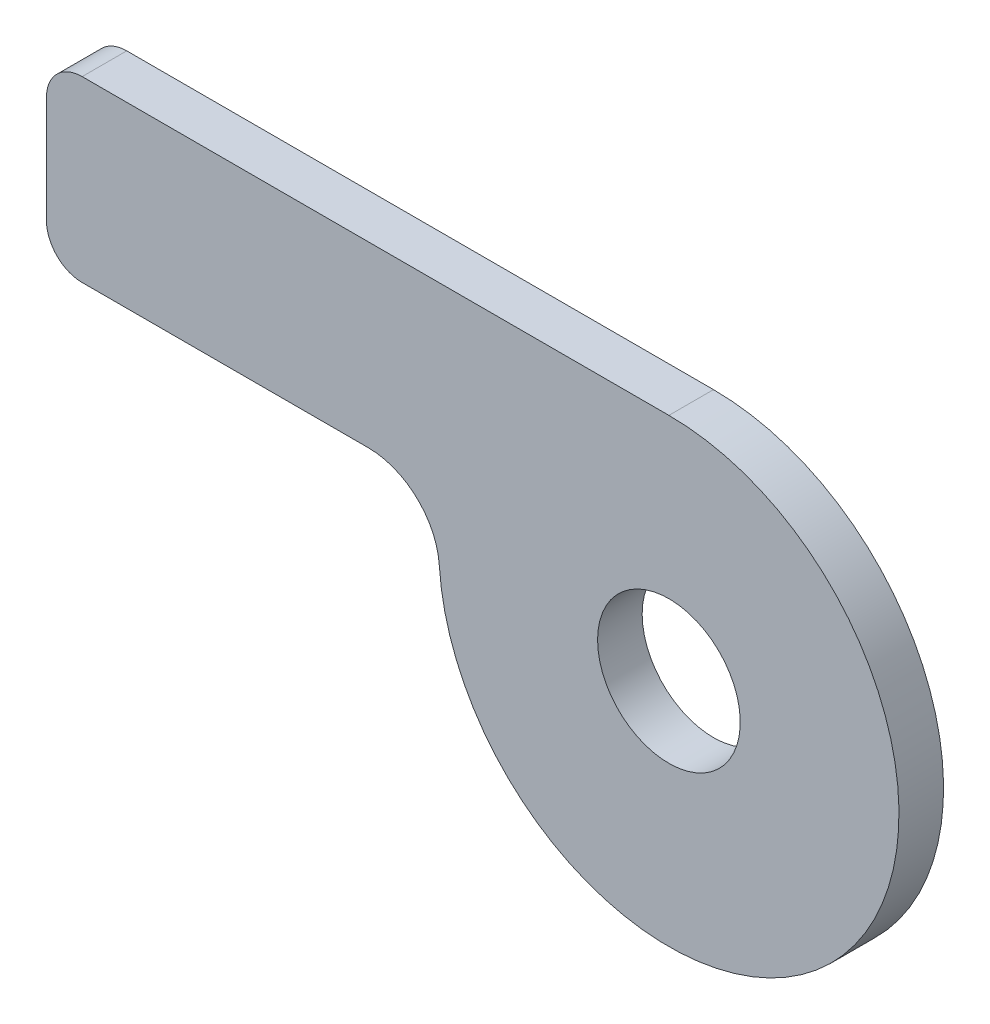
from build123d import *

# Parameters (mm, degrees)
SKETCH2_W           = 13.97
SKETCH2_H           = 6.35
BOSS_EXTRUDE1_DEPTH = 1.5875
WRAP1_START         = -0.0762
WRAP1_DEPTH         = 0.0762
BOSS_EXTRUDE2_DEPTH = 1.5875
FILLET1_R           = 2.54
SKETCH5_R           = 2.54
CUT_EXTRUDE1_DEPTH  = 33.375847382
FILLET2_R           = 1.27


# Read off the part's stored shape, not the designer's step: Wrap1
with BuildPart() as part:
    # Sketch2 → Boss-Extrude1 (new body)
    with BuildSketch(Plane.XY):
        with Locations((0, -9.144)):
            Rectangle(SKETCH2_W, SKETCH2_H)
    extrude(amount=BOSS_EXTRUDE1_DEPTH)

    # Wrap1 outline → Wrap1 (cut)
    # profile 1 of 3: a face of its own
    with BuildSketch(Plane(origin=(0, 0, 0), x_dir=(-1, 0, 0), z_dir=(0, 0, -1)).offset(WRAP1_START)):
        with BuildLine():
            add(Edge.make_bspline(
                [(-2.647697623, -7.156673999), (-2.700141722, -7.157990717), (-2.803561737, -7.160587291), (-2.95654894, -7.175584212), (-3.104871573, -7.200760896), (-3.248840584, -7.235209573), (-3.388264056, -7.279418681), (-3.523751822, -7.332718225), (-3.654761282, -7.396442796), (-3.780864658, -7.469338074), (-3.901337576, -7.550619015), (-4.013349659, -7.641820928), (-4.117563586, -7.741198922), (-4.213542217, -7.848882831), (-4.300966588, -7.965414437), (-4.379096688, -8.09075528), (-4.450765358, -8.223827059), (-4.490467199, -8.317653514), (-4.510645471, -8.365340362)],
                knots=[0, 0, 0, 0, 0.066519919, 0.131177599, 0.194761122, 0.257192137, 0.318771417, 0.380120674, 0.441686552, 0.503359563, 0.564724062, 0.625801011, 0.68633058, 0.747180128, 0.808544627, 0.870848624, 0.934359429, 1, 1, 1, 1], degree=3))
            add(Edge.make_bspline(
                [(-4.510645471, -8.365340362), (-4.527049856, -8.412005616), (-4.558801406, -8.50232867), (-4.59758291, -8.636036705), (-4.626063685, -8.763161633), (-4.644365509, -8.88229651), (-4.65610472, -8.990504557), (-4.66232732, -9.085306839), (-4.668515846, -9.165294299), (-4.667859131, -9.213742427), (-4.667564777, -9.235457917)],
                knots=[0, 0, 0, 0, 0.166884492, 0.32301371, 0.469462925, 0.606133475, 0.729510425, 0.836585524, 0.926754125, 1, 1, 1, 1], degree=3))
            add(Edge.make_bspline(
                [(-4.667564777, -9.235457917), (-4.664882988, -9.289623356), (-4.659653011, -9.395255787), (-4.644374873, -9.549374923), (-4.620634185, -9.694119159), (-4.591262562, -9.830361514), (-4.553570782, -9.956861765), (-4.509897614, -10.075001199), (-4.457883705, -10.18342197), (-4.399712241, -10.282754496), (-4.338280071, -10.373361413), (-4.276971758, -10.45640658), (-4.217321352, -10.532542421), (-4.159638706, -10.602224618), (-4.101572004, -10.663141537), (-4.044803736, -10.716879151), (-3.989521034, -10.76380347), (-3.950941988, -10.789800804), (-3.932397825, -10.802297194)],
                knots=[0, 0, 0, 0, 0.090547377, 0.176583808, 0.25842749, 0.335350079, 0.409134528, 0.478645697, 0.545446999, 0.609635042, 0.670678521, 0.72814981, 0.781962462, 0.832172751, 0.879124948, 0.922373067, 0.962686312, 1, 1, 1, 1], degree=3))
            add(Edge.make_bspline(
                [(-3.932397825, -10.802297194), (-3.899575004, -10.822649404), (-3.835101069, -10.862627292), (-3.737583222, -10.918047869), (-3.640336411, -10.966559062), (-3.543782489, -11.009176845), (-3.447774681, -11.045130285), (-3.352898685, -11.076135452), (-3.258471568, -11.100288494), (-3.165713454, -11.119157648), (-3.07638712, -11.13198399), (-2.993163041, -11.145490843), (-2.916110361, -11.154302727), (-2.845563977, -11.162560374), (-2.781457203, -11.168046007), (-2.723900707, -11.171284009), (-2.67284163, -11.172408774), (-2.640949134, -11.170953208), (-2.626044597, -11.170272969)],
                knots=[0, 0, 0, 0, 0.084081552, 0.165161565, 0.244101972, 0.320591348, 0.394832915, 0.467221523, 0.537793521, 0.606917259, 0.673196312, 0.734237149, 0.790455801, 0.842017783, 0.888878961, 0.930508014, 0.967523838, 1, 1, 1, 1], degree=3))
            add(Edge.make_bspline(
                [(-2.626044597, -11.170272969), (-2.573198179, -11.169500282), (-2.468940841, -11.167975898), (-2.31452666, -11.156444703), (-2.1645659, -11.134695327), (-2.01858399, -11.106488913), (-1.877449307, -11.067515025), (-1.74083699, -11.020193039), (-1.607748177, -10.9656962), (-1.480145536, -10.901229556), (-1.35779099, -10.828510117), (-1.24349382, -10.745290372), (-1.136598902, -10.652709329), (-1.03766187, -10.55077445), (-0.946982545, -10.438344739), (-0.864202915, -10.316678003), (-0.787834509, -10.185931816), (-0.745125833, -10.093148958), (-0.723398004, -10.045946136)],
                knots=[0, 0, 0, 0, 0.067400543, 0.132970243, 0.197314362, 0.260572886, 0.322477527, 0.383871407, 0.444888074, 0.505751373, 0.566046217, 0.626228389, 0.685817876, 0.746206759, 0.807157744, 0.869794079, 0.933758378, 1, 1, 1, 1], degree=3))
            add(Edge.make_bspline(
                [(-0.723398004, -10.045946136), (-0.706043581, -10.000912254), (-0.672558385, -9.914019796), (-0.634101881, -9.784992095), (-0.602792879, -9.664096552), (-0.585253436, -9.550632851), (-0.572532337, -9.447484954), (-0.564910042, -9.35638481), (-0.560236827, -9.277874137), (-0.560750774, -9.22997046), (-0.560986521, -9.207997039)],
                knots=[0, 0, 0, 0, 0.168452015, 0.325026598, 0.469881255, 0.604100278, 0.72552812, 0.832764842, 0.923289214, 1, 1, 1, 1], degree=3))
            add(Edge.make_bspline(
                [(-0.560986521, -9.207997039), (-0.562424525, -9.16560598), (-0.565233102, -9.082811624), (-0.575973872, -8.961425152), (-0.589529935, -8.845627784), (-0.608449503, -8.735388137), (-0.631822246, -8.630835315), (-0.660112228, -8.532163732), (-0.692174012, -8.438732757), (-0.740378275, -8.325583856), (-0.802896269, -8.198651325), (-0.876721713, -8.06410923), (-0.9479322, -7.952825593), (-0.99954015, -7.890763162), (-1.02311388, -7.862413984)],
                knots=[0, 0, 0, 0, 0.087686064, 0.171260436, 0.25188376, 0.328695577, 0.402424606, 0.473287836, 0.540840486, 0.606523137, 0.72744845, 0.833231732, 0.923822781, 1, 1, 1, 1], degree=3))
            add(Edge.make_bspline(
                [(-1.02311388, -7.862413984), (-1.048511615, -7.83498953), (-1.098291776, -7.78123695), (-1.175684211, -7.7057633), (-1.25272051, -7.635844746), (-1.331052054, -7.573197539), (-1.408258675, -7.515180288), (-1.487286191, -7.465431982), (-1.565605826, -7.419944121), (-1.668188131, -7.371224089), (-1.788408373, -7.32066759), (-1.91960177, -7.269682439), (-2.033787975, -7.233079786), (-2.104947594, -7.218029101), (-2.137240957, -7.211198861)],
                knots=[0, 0, 0, 0, 0.085369795, 0.16732682, 0.246857141, 0.322898047, 0.396382563, 0.467311641, 0.536076716, 0.603141744, 0.726535131, 0.833937052, 0.924638002, 1, 1, 1, 1], degree=3))
            add(Edge.make_bspline(
                [(-2.137240957, -7.211198861), (-2.191247875, -7.200678531), (-2.293584351, -7.180743798), (-2.41898947, -7.167631042), (-2.508035649, -7.160739322), (-2.563273907, -7.158863551), (-2.608768879, -7.156746289), (-2.63598111, -7.156964996), (-2.6480133, -7.1570617)],
                knots=[0, 0, 0, 0, 0.320661626, 0.607614386, 0.734513133, 0.841355612, 0.929853618, 1, 1, 1, 1], degree=3))
            Line((-2.6480133, -7.1570617), (-2.647697623, -7.156673999))
        make_face()
        with BuildLine():
            add(Edge.make_bspline(
                [(-2.61992643, -7.953886906), (-2.589521267, -7.955312702), (-2.529974217, -7.958105055), (-2.442626215, -7.966472798), (-2.359654779, -7.979988995), (-2.280855145, -7.99680592), (-2.206851711, -8.019201044), (-2.136813526, -8.044654383), (-2.071560252, -8.075356715), (-1.993452594, -8.120584734), (-1.907775865, -8.178611336), (-1.817709469, -8.244325989), (-1.746142565, -8.306748247), (-1.709188511, -8.350792684), (-1.692374723, -8.370832537)],
                knots=[0, 0, 0, 0, 0.087024922, 0.17043413, 0.250710803, 0.327276176, 0.400618799, 0.47159803, 0.540173201, 0.606489191, 0.729474301, 0.835807826, 0.925293924, 1, 1, 1, 1], degree=3))
            add(Edge.make_bspline(
                [(-1.692374723, -8.370832537), (-1.661765047, -8.410808729), (-1.60297182, -8.487592599), (-1.530753563, -8.60748298), (-1.47734558, -8.725848923), (-1.442820569, -8.840859568), (-1.421222002, -8.947092613), (-1.40567756, -9.040731541), (-1.397691899, -9.120767482), (-1.398549251, -9.169540718), (-1.398935619, -9.191520511)],
                knots=[0, 0, 0, 0, 0.169594167, 0.325746294, 0.470550185, 0.606055227, 0.729486621, 0.835705094, 0.925960049, 1, 1, 1, 1], degree=3))
            add(Edge.make_bspline(
                [(-1.398935619, -9.191520511), (-1.400370804, -9.238401621), (-1.403230634, -9.331819602), (-1.42390398, -9.470550085), (-1.459545927, -9.606149766), (-1.508983139, -9.737558144), (-1.570982491, -9.863808631), (-1.649770441, -9.98002566), (-1.740800666, -10.088663517), (-1.812306672, -10.150937334), (-1.848509433, -10.182465933)],
                knots=[0, 0, 0, 0, 0.125039944, 0.249161743, 0.373199202, 0.49837726, 0.623179526, 0.7474052, 0.872113829, 1, 1, 1, 1], degree=3))
            add(Edge.make_bspline(
                [(-1.848509433, -10.182465933), (-1.865471268, -10.196732579), (-1.901275668, -10.226847757), (-1.964514598, -10.266081795), (-2.03646415, -10.306254909), (-2.119290803, -10.345122546), (-2.214621903, -10.37965934), (-2.324686151, -10.402848049), (-2.448289934, -10.418636025), (-2.535499815, -10.421717805), (-2.581322595, -10.423337069)],
                knots=[0, 0, 0, 0, 0.084303421, 0.177954408, 0.282718587, 0.398119813, 0.526013007, 0.667850972, 0.825478585, 1, 1, 1, 1], degree=3))
            add(Edge.make_bspline(
                [(-2.581322595, -10.423337069), (-2.613774356, -10.422702421), (-2.67800681, -10.42144625), (-2.773339075, -10.412367944), (-2.866543033, -10.398895813), (-2.956916468, -10.377684048), (-3.045503761, -10.353432767), (-3.130656989, -10.320378265), (-3.214445042, -10.283944631), (-3.294839692, -10.240711619), (-3.372162148, -10.192342753), (-3.444221617, -10.137012985), (-3.512044778, -10.077047773), (-3.573292733, -10.010029583), (-3.630925848, -9.938994273), (-3.682749728, -9.861327172), (-3.73016348, -9.778397184), (-3.756604527, -9.719531325), (-3.769986343, -9.68973931)],
                knots=[0, 0, 0, 0, 0.065554628, 0.129753653, 0.193347498, 0.255646179, 0.317194151, 0.378728513, 0.43999687, 0.501694357, 0.562969549, 0.624053071, 0.685047397, 0.745616831, 0.807259991, 0.869690739, 0.934050474, 1, 1, 1, 1], degree=3))
            add(Edge.make_bspline(
                [(-3.769986343, -9.68973931), (-3.780419725, -9.662889022), (-3.80061919, -9.610905735), (-3.826006737, -9.534381417), (-3.844291008, -9.46171856), (-3.855876862, -9.393953413), (-3.862473829, -9.332290316), (-3.867303601, -9.278414348), (-3.870070982, -9.232348052), (-3.869768515, -9.204338176), (-3.869630103, -9.191520511)],
                knots=[0, 0, 0, 0, 0.168870828, 0.326941028, 0.472345087, 0.607709477, 0.729622887, 0.835819114, 0.924868802, 1, 1, 1, 1], degree=3))
            add(Edge.make_bspline(
                [(-3.869630103, -9.191520511), (-3.868165005, -9.158541563), (-3.865298573, -9.094018964), (-3.854954533, -8.999986364), (-3.840377416, -8.910774612), (-3.819930513, -8.826922784), (-3.794789428, -8.747985232), (-3.76508216, -8.674201943), (-3.730629858, -8.605127673), (-3.678067688, -8.523749463), (-3.612307913, -8.433743077), (-3.53593258, -8.340917298), (-3.464909244, -8.266628943), (-3.415272992, -8.228829209), (-3.39259541, -8.211559441)],
                knots=[0, 0, 0, 0, 0.087655819, 0.171496713, 0.251089441, 0.327575433, 0.400506175, 0.470932915, 0.538652936, 0.60513985, 0.727960176, 0.834505289, 0.92438954, 1, 1, 1, 1], degree=3))
            add(Edge.make_bspline(
                [(-3.39259541, -8.211559441), (-3.354905927, -8.184895617), (-3.282123632, -8.133405012), (-3.168249898, -8.071092767), (-3.055612248, -8.023526624), (-2.945165138, -7.994709656), (-2.844007588, -7.974796958), (-2.756293097, -7.961591648), (-2.683487442, -7.952914005), (-2.639921942, -7.953812362), (-2.620552422, -7.954211778)],
                knots=[0, 0, 0, 0, 0.167065237, 0.322620267, 0.469127337, 0.608592887, 0.735080541, 0.842368586, 0.929915989, 1, 1, 1, 1], degree=3))
            Line((-2.620552422, -7.954211778), (-2.61992643, -7.953886906))
        make_face(mode=Mode.SUBTRACT)
    # profile 2 of 3: a face of its own
    with BuildSketch(Plane(origin=(0, 0, 0), x_dir=(-1, 0, 0), z_dir=(0, 0, -1)).offset(WRAP1_START)):
        Polygon((-0.043692986, -11.069844612), (0.791482441, -11.069844612), (0.791482441, -9.462991678), (2.179826007, -9.462991678), (2.179826007, -8.726747438), (0.791482441, -8.726747438), (0.791482441, -8.002073699), (2.179826007, -8.002073699), (2.179826007, -7.27002368), (-0.043692986, -7.27002368), align=None)
    # profile 3 of 3: a face of its own
    with BuildSketch(Plane(origin=(0, 0, 0), x_dir=(-1, 0, 0), z_dir=(0, 0, -1)).offset(WRAP1_START)):
        Polygon((2.567444278, -11.069844612), (3.402619704, -11.069844612), (3.402619704, -9.462991678), (4.79096327, -9.462991678), (4.79096327, -8.726747438), (3.402619704, -8.726747438), (3.402619704, -8.002073699), (4.79096327, -8.002073699), (4.79096327, -7.27002368), (2.567444278, -7.27002368), align=None)
    extrude(amount=WRAP1_DEPTH, mode=Mode.SUBTRACT)

    # Sketch4 → Boss-Extrude2 (add, through all)
    with BuildSketch(Plane(origin=(0, 0, 0), x_dir=(-1, 0, 0), z_dir=(0, 0, -1))):
        with BuildLine():
            Line((-15.1765, -5.969), (-6.985, -5.969))
            Line((-6.985, -5.969), (-6.985, -14.1605))
            ThreePointArc((-6.985, -14.1605), (-20.968765198, -19.952765198), (-15.1765, -5.969))
        make_face()
    extrude(amount=-BOSS_EXTRUDE2_DEPTH)

    # Fillet1
    fillet1_edges = [part.edges().sort_by_distance(p)[0] for p in [
        (6.985, -12.319, 0.79375),
    ]]
    fillet(fillet1_edges, radius=FILLET1_R)

    # Sketch5 → Cut-Extrude1 (cut, through all)
    with BuildSketch(Plane(origin=(0, 0, 0), x_dir=(-1, 0, 0), z_dir=(0, 0, -1))):
        with Locations((-15.1765, -14.1605)):
            Circle(SKETCH5_R)
    extrude(amount=-CUT_EXTRUDE1_DEPTH, mode=Mode.SUBTRACT)

    # Fillet2
    fillet2_edges = [part.edges().sort_by_distance(p)[0] for p in [
        (-6.985, -5.969, 0.79375),
        (-6.985, -12.319, 0.79375),
    ]]
    fillet(fillet2_edges, radius=FILLET2_R)


solid = part.part
